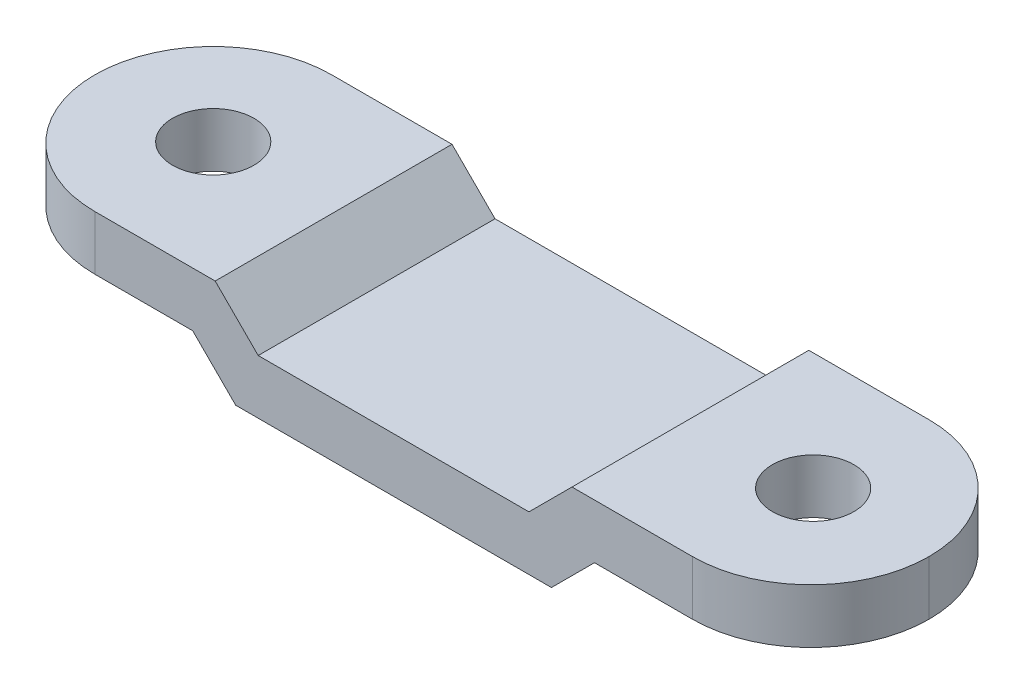
from build123d import *

# Parameters (mm, degrees)
BASE_EXTRUDE_DEPTH = 11.0744
SKETCH2_R          = 1.905
CUT_EXTRUDE1_DEPTH = 23.889284907
FILLET1_R          = 5.5372


with BuildPart() as part:
    # Sketch1 → Base-Extrude (new body)
    with BuildSketch(Plane.XY):
        Polygon((-8.342087552, -2.54), (-6.330407552, -4.55168), (6.330407552, -4.55168), (8.342087552, -2.54), (19.507927552, -2.54), (19.507927552, -5.08), (9.39419, -5.08), (7.38251, -7.09168), (-7.38251, -7.09168), (-9.39419, -5.08), (-19.507927552, -5.08), (-19.507927552, -2.54), align=None)
    extrude(amount=BASE_EXTRUDE_DEPTH)

    # Sketch2 → Cut-Extrude1 (cut, through all)
    with BuildSketch(Plane(origin=(0, -2.54, 0), x_dir=(-1, 0, 0), z_dir=(0, 1, 0))):
        with Locations((14.026607552, 5.481627302)):
            Circle(SKETCH2_R)
    cut_extrude1 = extrude(amount=-CUT_EXTRUDE1_DEPTH, mode=Mode.SUBTRACT)

    # Mirror1: Cut-Extrude1 across plane
    add(cut_extrude1.mirror(Plane(origin=(0, 0, 0), x_dir=(0, 0, 1), z_dir=(1, 0, 0))), mode=Mode.SUBTRACT)

    # Fillet1
    fillet1_edges = [part.edges().sort_by_distance(p)[0] for p in [
        (19.507927552, -3.81, 0),
        (-19.507927552, -3.81, 0),
        (19.507927552, -3.81, 11.0744),
        (-19.507927552, -3.81, 11.0744),
    ]]
    fillet(fillet1_edges, radius=FILLET1_R - 0.0001)  # a hair under: the kernel refuses the full size


solid = part.part
